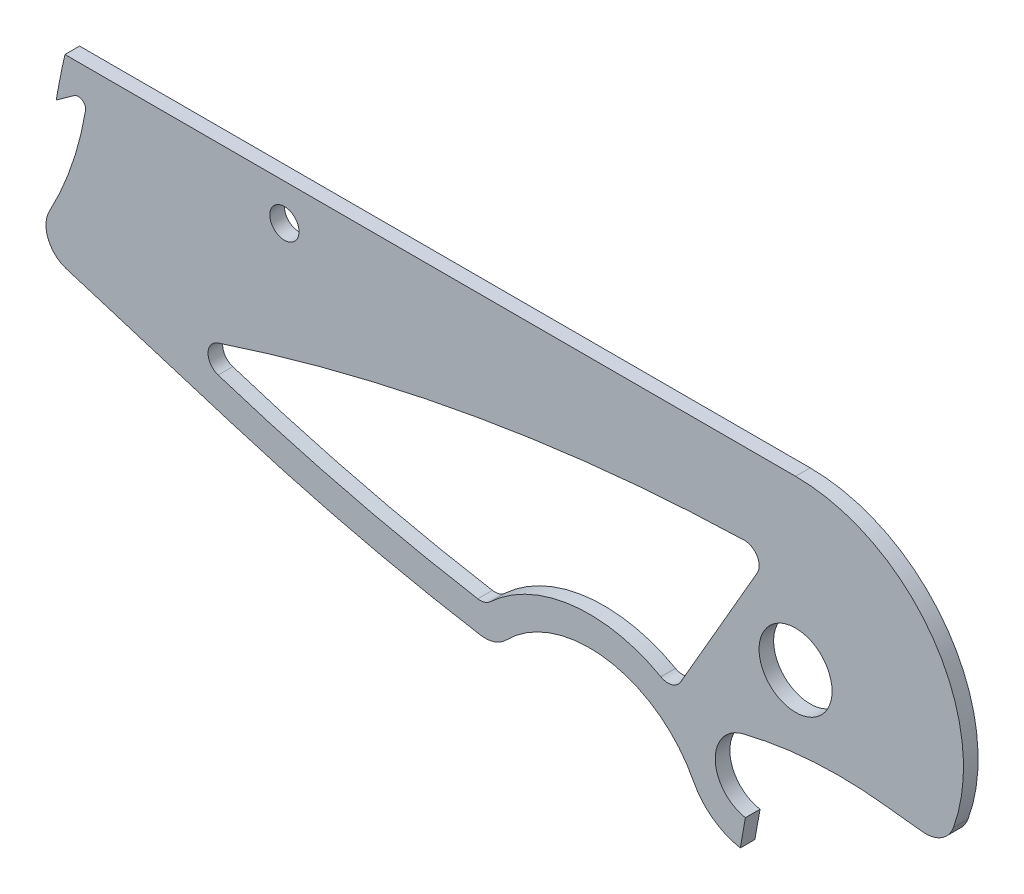
from build123d import *

# Parameters (mm, degrees)
SKICA1_R                       = 2.5
P_IDAT_VYSUNUT_M1_DEPTH        = 1
ODEBRAT_VYSUNUT_M13_DEPTH      = 53.848376335
ODEBRAT_VYSUNUT_M13_DEPTH_BACK = 53.848376335
ODEBRAT_VYSUNUT_M12_DEPTH      = 53.819985623
ODEBRAT_VYSUNUT_M12_DEPTH_BACK = 53.819985623
SKICA16_R                      = 1
ODEBRAT_VYSUNUT_M15_DEPTH      = 53.819985623


with BuildPart() as part:
    # Skica1 → Přidat vysunutím1 (new body)
    with BuildSketch(Plane.XY):
        with BuildLine():
            Line((0, 11.5), (-50.027230863, 11.5))
            ThreePointArc((-50.027230863, 11.5), (-50.959976214, 6.16884528), (-51.326233925, 0.769115673))
            ThreePointArc((-51.326233925, 0.769115673), (-50.944425281, -0.436513563), (-49.915705076, -1.172077587))
            Line((-49.915705076, -1.172077587), (-38.448343472, -4.707557447))
            ThreePointArc((-38.448343472, -4.707557447), (-30.083835229, -6.985089116), (-21.586571164, -8.70225307))
            ThreePointArc((-21.586571164, -8.70225307), (-20.636415349, -8.631497124), (-19.826816212, -8.129150916))
            ThreePointArc((-19.826816212, -8.129150916), (-12.91933355, -5.81580451), (-7, -10.061552813))
            ThreePointArc((-7, -10.061552813), (-5.668297006, -11.623560554), (-3.7814168, -12.431634889))
            Line((-3.7814168, -12.431634889), (-3.434120444, -10.462019383))
            ThreePointArc((-3.434120444, -10.462019383), (-5.49842143, -8.088827697), (-3.607870264, -5.575027064))
            ThreePointArc((-3.607870264, -5.575027064), (1.253972452, -4.817482892), (6.172618029, -4.952810098))
            ThreePointArc((6.172618029, -4.952810098), (7.453089356, -5.098574184), (8.735006444, -5.231022544))
            ThreePointArc((8.735006444, -5.231022544), (9.996764724, -4.932454173), (10.810257225, -3.92279731))
            ThreePointArc((10.810257225, -3.92279731), (9.417063477, 6.60067538), (0, 11.5))
        make_face()
        Circle(SKICA1_R, mode=Mode.SUBTRACT)
    extrude(amount=P_IDAT_VYSUNUT_M1_DEPTH)

    # Skica14 → Odebrat vysunutím13 (cut, two sides: drawn at the far end of the back side and taken through both)
    with BuildSketch(Plane.XY.offset(2).offset(-ODEBRAT_VYSUNUT_M13_DEPTH_BACK)):
        with BuildLine():
            Line((-7.869119097, -4.629714086), (-2.626247089, 4.451206608))
            ThreePointArc((-2.626247089, 4.451206608), (-2.633316833, 5.46325658), (-3.520210673, 5.950816261))
            ThreePointArc((-3.520210673, 5.950816261), (-21.76179058, 4.106504546), (-39.542588665, -0.365625))
            ThreePointArc((-39.542588665, -0.365625), (-40.228753357, -1.318341197), (-39.536435135, -2.26659518))
            ThreePointArc((-39.536435135, -2.26659518), (-30.725306719, -4.772615293), (-21.758030683, -6.644534429))
            ThreePointArc((-21.758030683, -6.644534429), (-21.304038727, -6.617599792), (-20.908925998, -6.392388554))
            ThreePointArc((-20.908925998, -6.392388554), (-15.292534392, -3.796568873), (-9.223868738, -5.002152405))
            ThreePointArc((-9.223868738, -5.002152405), (-8.470065988, -5.093940917), (-7.869119097, -4.629714086))
        make_face()
    extrude(amount=ODEBRAT_VYSUNUT_M13_DEPTH + ODEBRAT_VYSUNUT_M13_DEPTH_BACK, mode=Mode.SUBTRACT)

    # Skica13 → Odebrat vysunutím12 (cut, two sides: drawn at the far end of the back side and taken through both)
    with BuildSketch(Plane.XY.offset(-ODEBRAT_VYSUNUT_M12_DEPTH_BACK)):
        with BuildLine():
            Line((-165.547965178, -73.379828616), (-50.623352594, 8.5))
            Line((-50.623352594, 8.5), (-49.401701576, 9.370384278))
            ThreePointArc((-49.401701576, 9.370384278), (-48.846381241, 9.38704588), (-48.618476036, 8.880372908))
            ThreePointArc((-48.618476036, 8.880372908), (-49.55655452, 5.183086079), (-51.08654298, 1.688940053))
            ThreePointArc((-51.08654298, 1.688940053), (-51.261828191, 1.243474537), (-51.326233925, 0.769115673))
            Line((-51.326233925, 0.769115673), (-53.440504935, -140.324834481))
            Line((-53.440504935, -140.324834481), (-198.133246531, -382.630224799))
            Line((-198.133246531, -382.630224799), (-310.240706774, -315.685218935))
            Line((-310.240706774, -315.685218935), (-165.547965178, -73.379828616))
        make_face()
    extrude(amount=ODEBRAT_VYSUNUT_M12_DEPTH + ODEBRAT_VYSUNUT_M12_DEPTH_BACK, mode=Mode.SUBTRACT)

    # Skica16 → Odebrat vysunutím15 (cut, through all)
    with BuildSketch(Plane.XY):
        with Locations((-35, 9)):
            Circle(SKICA16_R)
    extrude(amount=ODEBRAT_VYSUNUT_M15_DEPTH, mode=Mode.SUBTRACT)


solid = part.part
